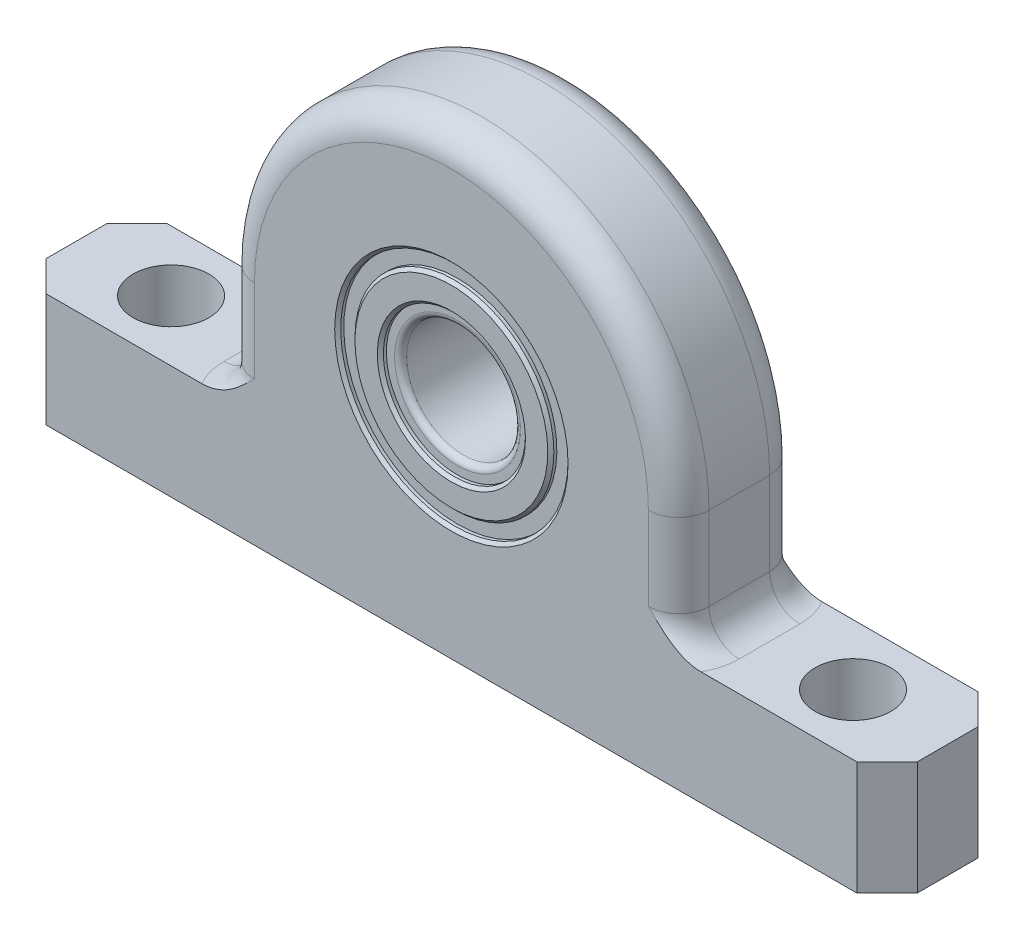
from build123d import *

# Parameters (mm, degrees)
EXTRUDE1_DEPTH      = 2.54
EXTRUDE1_DEPTH_BACK = 2.54
SKETCH3_R           = 4.7625
SKETCH4_R           = 1.5875
CUT_EXTRUDE1_DEPTH  = 24.321126052
FILLET1_R           = 1.27
FILLET2_R           = 1.27
CHAMFER1_SIZE       = 0.127
FILLET3_R           = 0.254
CHAMFER2_SIZE       = 0.127


with BuildPart() as part:
    # Sketch3 → Extrude1 (new, two sides: drawn at the far end of the back side and taken through both)
    with BuildSketch(Plane.XY.offset(-EXTRUDE1_DEPTH_BACK)):
        with BuildLine():
            Line((9.525, 0), (9.525, -4.7625))
            Line((9.525, -4.7625), (18.25625, -4.7625))
            Line((18.25625, -4.7625), (18.25625, -9.525))
            Line((18.25625, -9.525), (-18.25625, -9.525))
            Line((-18.25625, -9.525), (-18.25625, -4.7625))
            Line((-18.25625, -4.7625), (-9.525, -4.7625))
            Line((-9.525, -4.7625), (-9.525, 0))
            ThreePointArc((-9.525, 0), (0, 9.525), (9.525, 0))
        make_face()
        Circle(SKETCH3_R, mode=Mode.SUBTRACT)
    extrude(amount=EXTRUDE1_DEPTH + EXTRUDE1_DEPTH_BACK)

    # Sketch4 → Cut-Extrude1 (cut, through all)
    with BuildSketch(Plane(origin=(0, -4.7625, 0), x_dir=(1, 0, 0), z_dir=(0, 1, 0))):
        with Locations(Location((-14.2875, 0, 0), (0, 0, 270))):
            Circle(SKETCH4_R)
        with Locations(Location((14.2875, 0, 0), (0, 0, 270))):
            Circle(SKETCH4_R)
        Polygon((-18.25625, 2.54), (-18.25625, 1.27), (-16.98625, 2.54), align=None)
        Polygon((16.98625, 2.54), (18.25625, 2.54), (18.25625, 1.27), align=None)
        Polygon((18.25625, -2.54), (18.25625, -1.27), (16.98625, -2.54), align=None)
        Polygon((-16.98625, -2.54), (-18.25625, -2.54), (-18.25625, -1.27), align=None)
    extrude(amount=-CUT_EXTRUDE1_DEPTH, mode=Mode.SUBTRACT)

    # Fillet1
    fillet1_edges = [part.edges().sort_by_distance(p)[0] for p in [
        (0, 9.525, -2.54),
        (9.525, -2.38125, -2.54),
        (9.525, -2.38125, 2.54),
        (-9.525, -2.38125, -2.54),
        (0, 9.525, 2.54),
        (-9.525, -2.38125, 2.54),
    ]]
    fillet(fillet1_edges, radius=FILLET1_R)

    # Fillet2
    # the kernel refuses this fillet: 1.27 mm, written as the material it adds along each edge
    with BuildSketch(Plane(origin=(-9.525, -4.7625, -1.27), x_dir=(0, 1, 0), z_dir=(0, 0, 1)), Plane(origin=(9.525, -4.7625, 1.27), x_dir=(0, 1, 0), z_dir=(0, 0, -1))) as fillet2_piece_1:
        with BuildLine():
            CenterArc((FILLET2_R, FILLET2_R), FILLET2_R, 180, 90)
            Line((0, FILLET2_R), (0, 0))
            Line((0, 0), (FILLET2_R, 0))
        make_face()
    extrude(amount=2.54)
    with BuildSketch(Plane(origin=(8.255, -4.7625, -1.27), x_dir=(-0.5976672776328268, 0, 0.8017442392976488), z_dir=(0.8017442392976488, 0, 0.5976672776328268))) as fillet2_piece_2_section:
        with BuildLine():
            CenterArc((1.27 + FILLET2_R, -FILLET2_R), FILLET2_R, 90, 90)
            Line((1.27 + FILLET2_R, 0), (1.27, 0))
            Line((1.27, 0), (1.27, -FILLET2_R))
        make_face()
    fillet2_piece_2 = revolve(axis=Axis((8.255, -4.7625, -1.27), (0, -1, 0)), revolution_arc=233.296989237, mode=Mode.PRIVATE)
    fillet2_piece_2 = split(fillet2_piece_2, bisect_by=Plane(origin=(9.207422318, -4.366731678, -2.54), z_dir=(0, 0, 1)), keep=Keep.TOP, mode=Mode.PRIVATE)
    add(fillet2_piece_2)
    with BuildSketch(Plane(origin=(-8.255, -4.7625, -1.27), x_dir=(0.5976672776328281, 0, 0.8017442392976479), z_dir=(-0.8017442392976479, 0, 0.5976672776328281))) as fillet2_piece_3_section:
        with BuildLine():
            CenterArc((1.27 + FILLET2_R, FILLET2_R), FILLET2_R, 180, 90)
            Line((1.27, FILLET2_R), (1.27, 0))
            Line((1.27, 0), (1.27 + FILLET2_R, 0))
        make_face()
    fillet2_piece_3 = revolve(axis=Axis((-8.255, -4.7625, -1.27), (0, 1, 0)), revolution_arc=233.296989237, mode=Mode.PRIVATE)
    fillet2_piece_3 = split(fillet2_piece_3, bisect_by=Plane(origin=(-9.207422451, -4.366732131, -2.54), z_dir=(0, 0, 1)), keep=Keep.TOP, mode=Mode.PRIVATE)
    add(fillet2_piece_3)
    with BuildSketch(Plane(origin=(8.255, -4.7625, 1.27), x_dir=(1, 0, 0), z_dir=(0, 0, -1))) as fillet2_piece_4_section:
        with BuildLine():
            CenterArc((1.27 + FILLET2_R, -FILLET2_R), FILLET2_R, 90, 90)
            Line((1.27 + FILLET2_R, 0), (1.27, 0))
            Line((1.27, 0), (1.27, -FILLET2_R))
        make_face()
    fillet2_piece_4 = revolve(axis=Axis((8.255, -4.7625, 1.27), (0, -1, 0)), revolution_arc=233.296989237, mode=Mode.PRIVATE)
    fillet2_piece_4 = split(fillet2_piece_4, bisect_by=Plane(origin=(9.207422382, -4.366731938, 2.54), z_dir=(0, 0, -1)), keep=Keep.TOP, mode=Mode.PRIVATE)
    add(fillet2_piece_4)
    with BuildSketch(Plane(origin=(-8.255, -4.7625, 1.27), x_dir=(-1, 0, 0), z_dir=(0, 0, -1))) as fillet2_piece_5_section:
        with BuildLine():
            CenterArc((1.27 + FILLET2_R, FILLET2_R), FILLET2_R, 180, 90)
            Line((1.27, FILLET2_R), (1.27, 0))
            Line((1.27, 0), (1.27 + FILLET2_R, 0))
        make_face()
    fillet2_piece_5 = revolve(axis=Axis((-8.255, -4.7625, 1.27), (0, 1, 0)), revolution_arc=233.296989237, mode=Mode.PRIVATE)
    fillet2_piece_5 = split(fillet2_piece_5, bisect_by=Plane(origin=(-9.804114567, -4.550028742, 2.54), z_dir=(0, 0, -1)), keep=Keep.TOP, mode=Mode.PRIVATE)
    add(fillet2_piece_5)

    # Chamfer1
    chamfer1_edges = [part.edges().sort_by_distance(p)[0] for p in [
        (-4.7625, 0, 2.54),
        (-4.7625, 0, -2.54),
    ]]
    chamfer(chamfer1_edges, length=CHAMFER1_SIZE)

    # Sketch5 → Revolve1 (revolve)
    with BuildSketch(Plane(origin=(0, 0, 0), x_dir=(0, 0, -1), z_dir=(1, 0, 0))):
        Polygon((-2.286, 4.7625), (-2.286, 4.1671875), (-2.54, 4.1671875), (-2.54, 2.9765625), (-2.286, 2.9765625), (-2.286, 2.38125), (2.286, 2.38125), (2.286, 2.9765625), (2.54, 2.9765625), (2.54, 4.1671875), (2.286, 4.1671875), (2.286, 4.7625), align=None)
    revolve(axis=Axis((0, 0, 0), (0, 0, 1)))

    # Fillet3
    fillet3_edges = [part.edges().sort_by_distance(p)[0] for p in [
        (0, -2.38125, -2.286),
        (0, -2.38125, 2.286),
    ]]
    fillet(fillet3_edges, radius=FILLET3_R)

    # Chamfer2
    chamfer2_edges = [part.edges().sort_by_distance(p)[0] for p in [
        (0, -4.1671875, -2.54),
        (0, -2.9765625, -2.54),
        (0, -2.9765625, 2.54),
        (0, -4.1671875, 2.54),
    ]]
    chamfer(chamfer2_edges, length=CHAMFER2_SIZE)


solid = part.part
